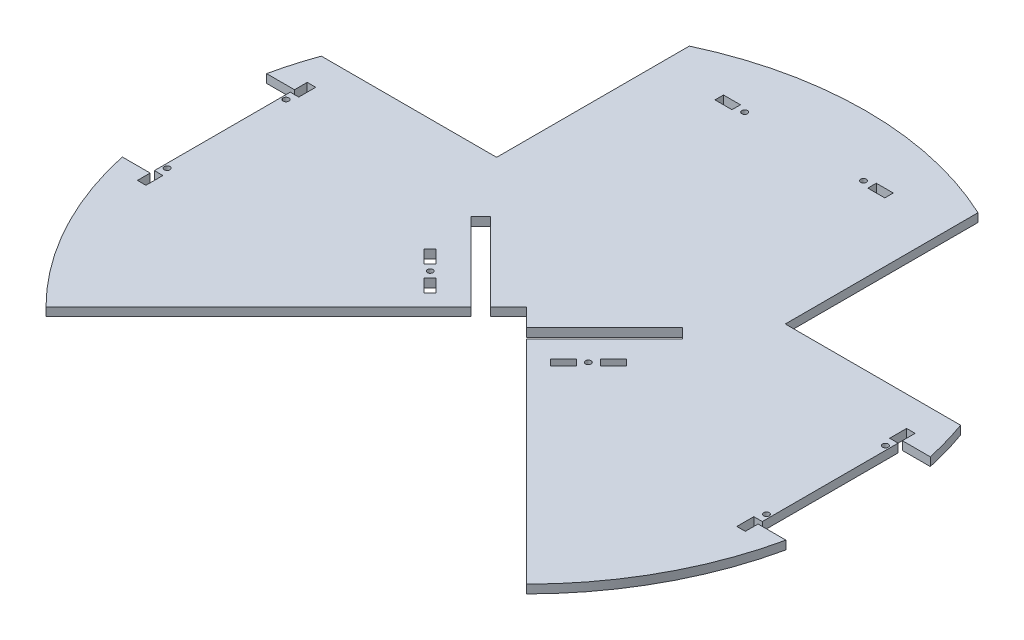
from build123d import *

# Parameters (mm, degrees)
SKETCH1_R                   = 254
BASE_PLATE_DEPTH            = 6.35
V_FUNNEL_CUT_DEPTH          = 360.266367059
SKETCH4_W                   = 26.67
SKETCH4_H                   = 107.95
WHEEL_HOLE_SLOT_DEPTH       = 360.266367059
SKETCH6_R                   = 2.0955
ARM_POST_CONNECTOR_DEPTH    = 356.188713046
SKETCH8_R                   = 2.1336
SKETCH8_W                   = 6.35
SKETCH8_H                   = 12.7
MOTOR_MOUNT_CONNECTOR_DEPTH = 356.188713046
SKETCH9_R                   = 2.1336
SKETCH9_W                   = 12.7
SKETCH9_H                   = 6.35
BACK_MOUNT_CONNECTOR_DEPTH  = 356.188713046
CUT_EXTRUDE2_DEPTH          = 356.188713046
SKETCH17_W                  = 164.760120997
SKETCH17_H                  = 168.221384869
CUT_EXTRUDE4_DEPTH          = 356.188713046


with BuildPart() as part:
    # Sketch1 → Base Plate (new body)
    with BuildSketch(Plane(origin=(0, 0, 0), x_dir=(1, 0, 0), z_dir=(0, 1, 0))):
        Circle(SKETCH1_R)
    extrude(amount=BASE_PLATE_DEPTH)

    # Sketch2 → V Funnel Cut (cut, through all)
    with BuildSketch(Plane(origin=(0, 6.35, 0), x_dir=(1, 0, 0), z_dir=(0, 1, 0))):
        with BuildLine():
            Line((0, 0), (-179.605122421, -179.605122421))
            ThreePointArc((-179.605122421, -179.605122421), (0, -254), (179.605122421, -179.605122421))
            Line((179.605122421, -179.605122421), (0, 0))
        make_face()
    extrude(amount=-V_FUNNEL_CUT_DEPTH, mode=Mode.SUBTRACT)

    # Sketch4 → Wheel Hole Slot (cut, through all)
    with BuildSketch(Plane(origin=(0, 6.35, 0), x_dir=(1, 0, 0), z_dir=(0, 1, 0))):
        with Locations((-240.665, 0)):
            Rectangle(SKETCH4_W, SKETCH4_H)
    wheel_hole_slot = extrude(amount=-WHEEL_HOLE_SLOT_DEPTH, mode=Mode.SUBTRACT)

    # Wheel Slot Mirror: Wheel Hole Slot across plane
    add(wheel_hole_slot.mirror(Plane(origin=(0, 0, 0), x_dir=(0, 0, 1), z_dir=(1, 0, 0))), mode=Mode.SUBTRACT)

    # Sketch6 → Arm Post Connector (cut, through all)
    with BuildSketch(Plane(origin=(0, 6.35, 0), x_dir=(1, 0, 0), z_dir=(0, 1, 0))):
        with Locations((-59.123400668, -12.718648301)):
            Circle(SKETCH6_R)
        Polygon((-61.368464698, -5.98345621), (-71.1004567, 3.748535792), (-75.59058476, -0.741592269), (-65.858592758, -10.473584271), align=None)
        Polygon((-52.388208577, -14.963712331), (-42.656216575, -24.695704333), (-47.146344636, -29.185832393), (-56.878336637, -19.453840392), align=None)
    arm_post_connector = extrude(amount=-ARM_POST_CONNECTOR_DEPTH, mode=Mode.SUBTRACT)

    # Arm Post Connector Mirror: Arm Post Connector across plane
    add(arm_post_connector.mirror(Plane(origin=(0, 0, 0), x_dir=(0, 0, 1), z_dir=(1, 0, 0))), mode=Mode.SUBTRACT)

    # Sketch8 → Motor Mount Connector (cut, through all)
    with BuildSketch(Plane.XZ):
        with Locations((-224.155, -44.45)):
            Circle(SKETCH8_R)
        with Locations((-224.155, 44.45)):
            Circle(SKETCH8_R)
        with Locations((-224.155, -57.15)):
            Rectangle(SKETCH8_W, SKETCH8_H)
        with Locations((-224.155, 57.15)):
            Rectangle(SKETCH8_W, SKETCH8_H)
    motor_mount_connector = extrude(amount=-MOTOR_MOUNT_CONNECTOR_DEPTH, mode=Mode.SUBTRACT)

    # Motor Mount Connector Mirror: Motor Mount Connector across plane
    add(motor_mount_connector.mirror(Plane(origin=(0, 0, 0), x_dir=(0, 0, 1), z_dir=(1, 0, 0))), mode=Mode.SUBTRACT)

    # Sketch9 → Back Mount Connector (cut, through all)
    with BuildSketch(Plane.XZ):
        with Locations((-44.45, -207.81727558)):
            Circle(SKETCH9_R)
        with Locations((44.45, -207.81727558)):
            Circle(SKETCH9_R)
        with Locations((-57.15, -207.81727558)):
            Rectangle(SKETCH9_W, SKETCH9_H)
        with Locations((57.15, -207.81727558)):
            Rectangle(SKETCH9_W, SKETCH9_H)
    extrude(amount=-BACK_MOUNT_CONNECTOR_DEPTH, mode=Mode.SUBTRACT)

    # Sketch16 → Cut-Extrude2 (cut, through all)
    with BuildSketch(Plane(origin=(0, 6.35, 0), x_dir=(1, 0, 0), z_dir=(0, 1, 0))):
        Polygon((20.669579742, -20.669579742), (79.044935611, 37.698393963), (71.816173913, 44.92715566), (13.444509127, -13.444509127), align=None)
        Polygon((-79.044935611, 37.698393963), (-71.816173913, 44.92715566), (-13.444509127, -13.444509127), (-20.669579742, -20.669579742), align=None)
    extrude(amount=-CUT_EXTRUDE2_DEPTH, mode=Mode.SUBTRACT)

    # Sketch17 → Cut-Extrude4 (cut, through all)
    with BuildSketch(Plane(origin=(0, 6.35, 0), x_dir=(1, 0, 0), z_dir=(0, 1, 0))):
        with Locations((-190.330685079, 169.889307566)):
            Rectangle(SKETCH17_W, SKETCH17_H)
        with Locations((190.330685079, 169.889307566)):
            Rectangle(SKETCH17_W, SKETCH17_H)
    extrude(amount=-CUT_EXTRUDE4_DEPTH, mode=Mode.SUBTRACT)


solid = part.part
